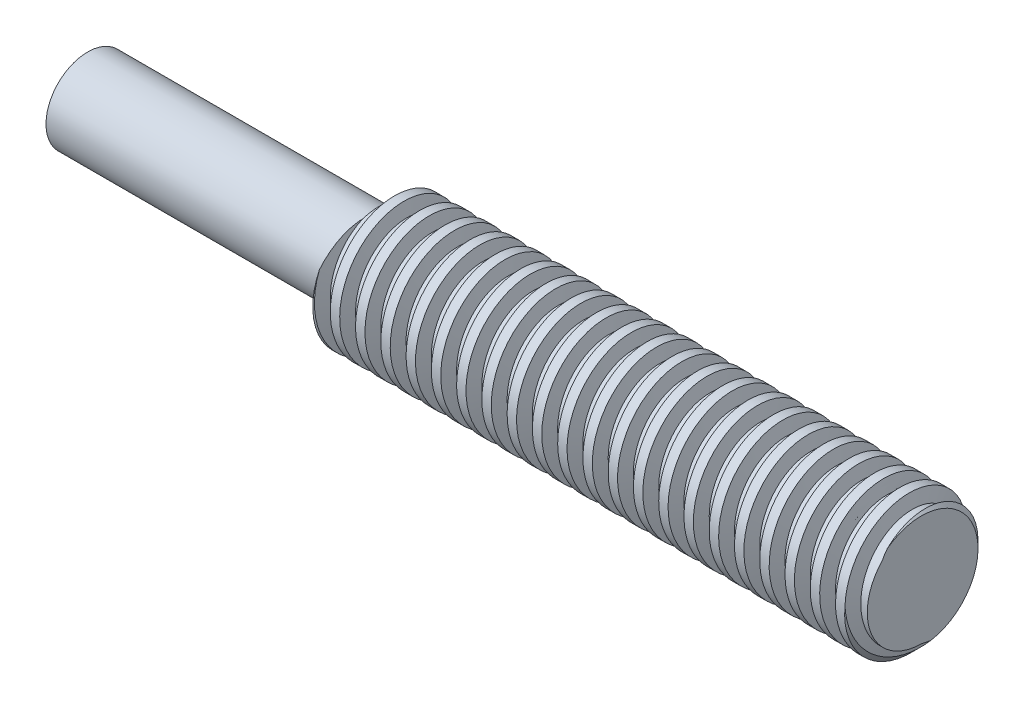
from build123d import *

# Parameters (mm, degrees)
SKETCH1_R               = 8
BOSS_EXTRUDE1_DEPTH     = 100
CUT_SWEEP4_PITCH        = 3.03030303
SKETCH7_OUTSIDE_W       = 63.906
SKETCH7_OUTSIDE_H       = 63.906
SKETCH7_OUTSIDE_R       = 6.8
CUT_EXTRUDE1_DEPTH      = 12.7
CUT_EXTRUDE1_DRAFT      = 45
MIRROR1_COPY_1_SKETCH_W = 63.906
MIRROR1_COPY_1_SKETCH_H = 63.906
MIRROR1_COPY_1_SKETCH_R = 6.8
MIRROR1_COPY_1_DEPTH    = 12.7
MIRROR1_COPY_1_DRAFT    = 45
SKETCH8_R               = 19.956827863
SKETCH8_R_2             = 5
CUT_EXTRUDE2_DEPTH      = 35


with BuildPart() as part:
    # Sketch1 → Boss-Extrude1 (new body)
    with BuildSketch(Plane(origin=(0, 0, 0), x_dir=(0, 0, -1), z_dir=(1, 0, 0))):
        Circle(SKETCH1_R)
    extrude(amount=BOSS_EXTRUDE1_DEPTH)

    # Cut-Sweep4: arcs per turn and ends read off the stored shape
    # Cut-Sweep4: the profile of Sketch2 profile screwed along a right-hand helix through 37.3 turns, 10 arcs to a turn; built about Z, then put on its axis
    cut_sweep4_z = Axis((0, 0, 0), (0, 0, 1))
    cut_sweep4_corners = [(8.0003, 0, -4.937376956), (8.0003, 0, -3.030225445), (6.484848485, 0, -3.422147855), (6.484848485, 0, -4.545454545)]
    with BuildLine(mode=Mode.PRIVATE) as cut_sweep4_profile:
        Line(cut_sweep4_corners[0], cut_sweep4_corners[1])
        Line(cut_sweep4_corners[1], cut_sweep4_corners[2])
        Line(cut_sweep4_corners[2], cut_sweep4_corners[3])
        Line(cut_sweep4_corners[3], cut_sweep4_corners[0])
    cut_sweep4_cap = Face(cut_sweep4_profile.wire())
    cut_sweep4_turn_angles = [0, 18, 36, 54, 72, 90, 108, 126, 144, 162, 180, 198, 216, 234, 252, 270, 288, 306, 324, 342, 360]
    cut_sweep4_turn_weights = [1, 0.9510565162951535, 1, 0.9510565162951535, 1, 0.9510565162951535, 1, 0.9510565162951535, 1, 0.9510565162951535, 1, 0.9510565162951535, 1, 0.9510565162951535, 1, 0.9510565162951535, 1, 0.9510565162951535, 1, 0.9510565162951535, 1]
    cut_sweep4_turn_rails = [Edge.make_bspline([Vector(p[0], p[1], 0).rotate(cut_sweep4_z, cut_sweep4_turn_angles[k]) / cut_sweep4_turn_weights[k] + Vector(0, 0, p[2] + CUT_SWEEP4_PITCH * cut_sweep4_turn_angles[k] / 360) for k in range(21)], [0, 0, 0, 1, 1, 2, 2, 3, 3, 4, 4, 5, 5, 6, 6, 7, 7, 8, 8, 9, 9, 10, 10, 10], 2, cut_sweep4_turn_weights) for p in cut_sweep4_corners]
    cut_sweep4_turn_sides = [Face.make_surface_from_curves(cut_sweep4_turn_rails[p[0]], cut_sweep4_turn_rails[p[1]]) for p in [(0, 1), (1, 2), (2, 3), (3, 0)]]
    cut_sweep4_last_angles = [13320, 13338, 13356, 13374, 13392, 13410, 13428]
    cut_sweep4_last_weights = [1, 0.9510565162951535, 1, 0.9510565162951535, 1, 0.9510565162951535, 1]
    cut_sweep4_last_rails = [Edge.make_bspline([Vector(p[0], p[1], 0).rotate(cut_sweep4_z, cut_sweep4_last_angles[k]) / cut_sweep4_last_weights[k] + Vector(0, 0, p[2] + CUT_SWEEP4_PITCH * cut_sweep4_last_angles[k] / 360) for k in range(7)], [0, 0, 0, 1, 1, 2, 2, 3, 3, 3], 2, cut_sweep4_last_weights) for p in cut_sweep4_corners]
    cut_sweep4_last_sides = [Face.make_surface_from_curves(cut_sweep4_last_rails[p[0]], cut_sweep4_last_rails[p[1]]) for p in [(0, 1), (1, 2), (2, 3), (3, 0)]]
    cut_sweep4 = Plane(origin=(0, 0, 0), x_dir=(0, 1, 0), z_dir=(1, 0, 0)) * Solid(Shell([*[p.moved(Location((0, 0, CUT_SWEEP4_PITCH * i))) for i in range(37) for p in cut_sweep4_turn_sides], *cut_sweep4_last_sides, cut_sweep4_cap, cut_sweep4_cap.rotate(cut_sweep4_z, 13428).moved(Location((0, 0, CUT_SWEEP4_PITCH * 13428 / 360)))]))
    add(cut_sweep4, mode=Mode.SUBTRACT)


with BuildPart() as cut_extrude1_tool:
    # Sketch7 outside → Cut-Extrude1 (with draft: the straight prism first)
    with BuildSketch(Plane(origin=(0, 0, 0), x_dir=(0, 0, -1), z_dir=(1, 0, 0))):
        Rectangle(SKETCH7_OUTSIDE_W, SKETCH7_OUTSIDE_H)
        Circle(SKETCH7_OUTSIDE_R, mode=Mode.SUBTRACT)
    extrude(amount=CUT_EXTRUDE1_DEPTH)
    # Cut-Extrude1: the draft: its side faces are tilted about the plane it starts from
    cut_extrude1_sides = [cut_extrude1_tool.faces().sort_by_distance(p)[0] for p in [
        (6.35, -31.953, 0),
        (6.35, 0, -31.953),
        (6.35, 31.953, 0),
        (6.35, 0, 31.953),
        (6.35, 0, 6.8),
    ]]
    draft(cut_extrude1_sides, Plane(origin=(0, 0, 0), x_dir=(0, 0, -1), z_dir=(1, 0, 0)), CUT_EXTRUDE1_DRAFT)


with BuildPart() as part_1:
    add(part.part)

    # Cut-Extrude1: cut by cut_extrude1_tool
    add(cut_extrude1_tool.part, mode=Mode.SUBTRACT)


with BuildPart() as mirror1_copy_1_tool:
    # Mirror1 copy 1 sketch → Mirror1 copy 1 (with draft: the straight prism first)
    with BuildSketch(Plane(origin=(100, 0, 0), x_dir=(0, 0, -1), z_dir=(-1, 0, 0))):
        Rectangle(MIRROR1_COPY_1_SKETCH_W, MIRROR1_COPY_1_SKETCH_H)
        Circle(MIRROR1_COPY_1_SKETCH_R, mode=Mode.SUBTRACT)
    extrude(amount=MIRROR1_COPY_1_DEPTH)
    # Mirror1 copy 1: the draft: its side faces are tilted about the plane it starts from
    mirror1_copy_1_sides = [mirror1_copy_1_tool.faces().sort_by_distance(p)[0] for p in [
        (93.65, -31.953, 0),
        (93.65, 0, -31.953),
        (93.65, 31.953, 0),
        (93.65, 0, 31.953),
        (93.65, 0, 6.8),
    ]]
    draft(mirror1_copy_1_sides, Plane(origin=(100, 0, 0), x_dir=(0, 0, -1), z_dir=(-1, 0, 0)), MIRROR1_COPY_1_DRAFT)


with BuildPart() as part_2:
    add(part_1.part)

    # Mirror1 copy 1: cut by mirror1_copy_1_tool
    add(mirror1_copy_1_tool.part, mode=Mode.SUBTRACT)

    # Sketch8 → Cut-Extrude2 (cut)
    with BuildSketch(Plane.ZY):
        Circle(SKETCH8_R)
        Circle(SKETCH8_R_2, mode=Mode.SUBTRACT)
    extrude(amount=-CUT_EXTRUDE2_DEPTH, mode=Mode.SUBTRACT)


solid = part_2.part
